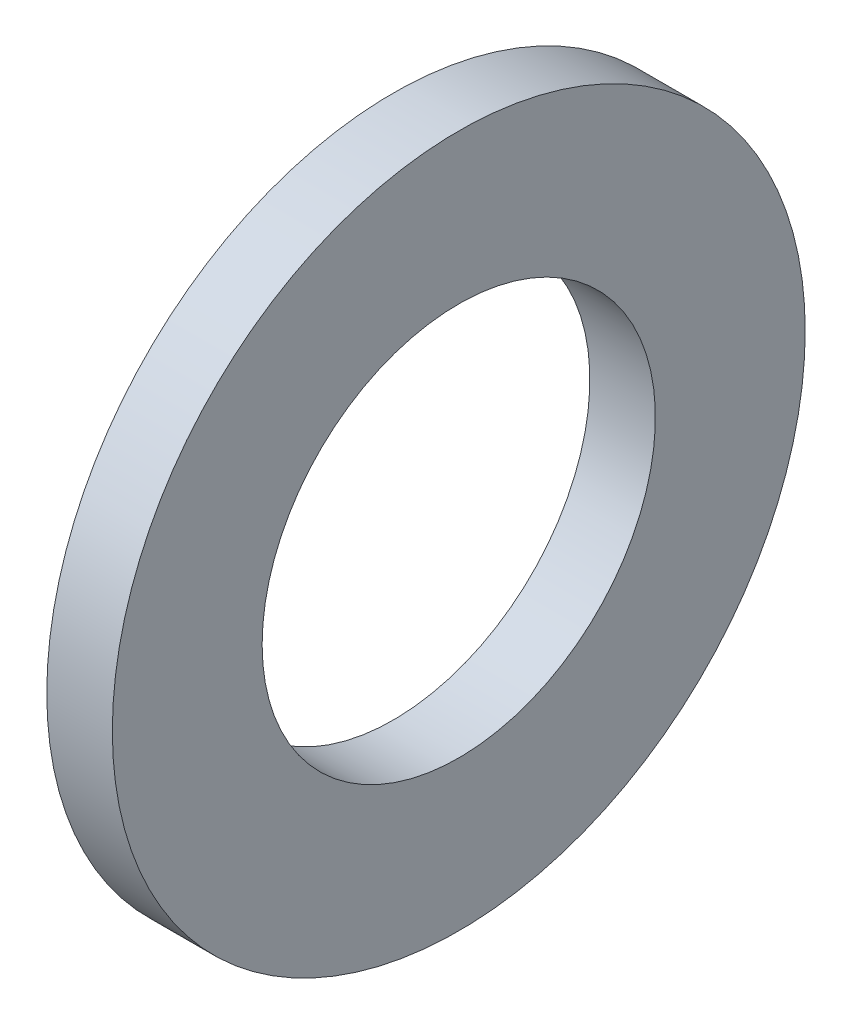
from build123d import *

# Parameters (mm, degrees)
SKETCH1_W = 3.5
SKETCH1_H = 8


with BuildPart() as part:
    # Sketch1 → Base-Revolve (revolve)
    with BuildSketch(Plane.XY):
        with Locations((-1.75, 14.5)):
            Rectangle(SKETCH1_W, SKETCH1_H)
    revolve(axis=Axis((-34.925, 0, 0), (1, 0, 0)))


solid = part.part
